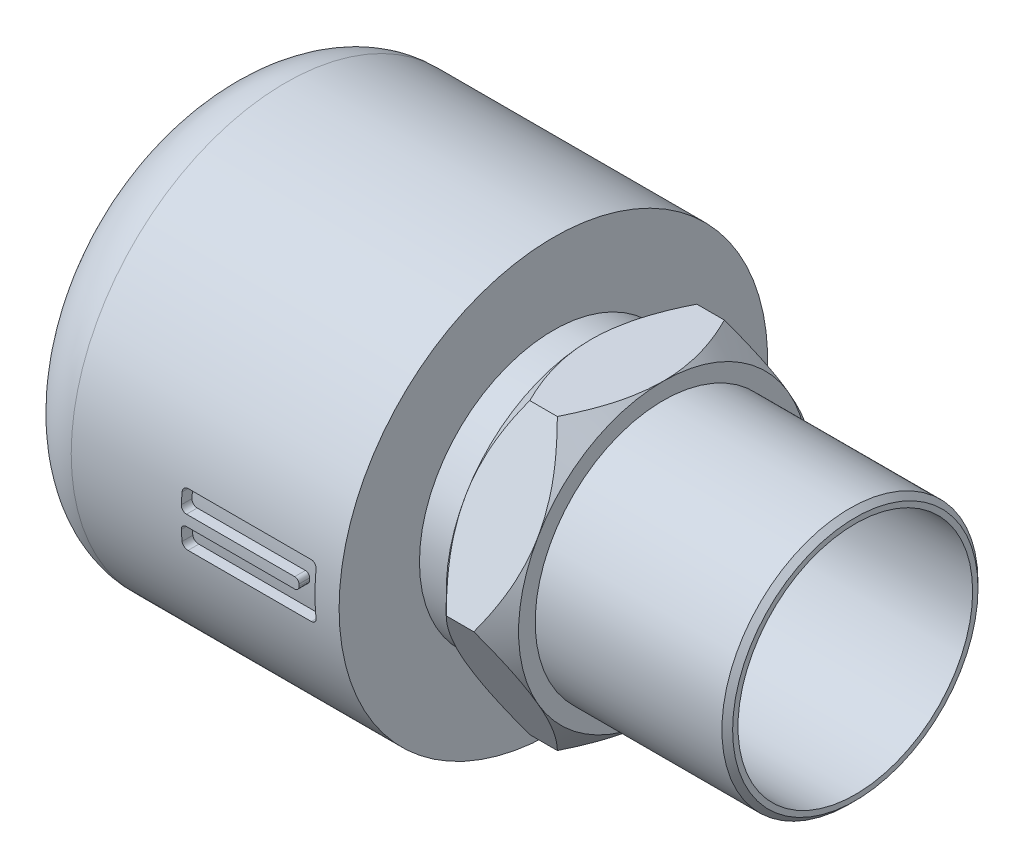
from build123d import *

# Parameters (mm, degrees)
EXTRUDE_1_DEPTH            = 13.5
SKETCH_2_OUTSIDE_W         = 121.07
SKETCH_2_OUTSIDE_H         = 112.716
SKETCH_2_OUTSIDE_R         = 27
CUT_EXTRUDE_1_DEPTH        = 20
CUT_EXTRUDE_1_DRAFT        = -45
SKETCH_3_OUTSIDE_W         = 121.07
SKETCH_3_OUTSIDE_H         = 112.716
SKETCH_3_OUTSIDE_R         = 27
CUT_EXTRUDE_2_DEPTH        = 20
CUT_EXTRUDE_2_DRAFT        = -45
SKETCH_4_R                 = 25
EXTRUDE_2_DEPTH            = 50
SKETCH_5_R                 = 20
CUT_EXTRUDE_3_DEPTH        = 36.5
SKETCH_6_R                 = 23.9
EXTRUDE_3_DEPTH            = 35.85
CHAMFER_1_SIZE             = 1
FILLET_1_R                 = 1
SKETCH_7_R                 = 21.9
CUT_EXTRUDE_4_DEPTH        = 96.24296562
EXTRUDE_START              = 7
SKETCH_8_R                 = 40
EXTRUDE_4_DEPTH            = 50
CUT_EXTRUDE_5_REACH        = 110.725
CUT_EXTRUDE_5_START_RADIUS = 40
CUT_EXTRUDE_5_END_RADIUS   = 40


# Read off the part's stored shape, not the designer's step: Купол1
with BuildPart() as part:
    # Эскиз1 → Бобышка-Вытянуть1 (new body)
    with BuildSketch(Plane(origin=(0, 0, 0), x_dir=(0, 0, -1), z_dir=(1, 0, 0))):
        Polygon((31.176914536, 0), (15.588457268, 27), (-15.588457268, 27), (-31.176914536, 0), (-15.588457268, -27), (15.588457268, -27), align=None)
    extrude(amount=-EXTRUDE_1_DEPTH)


with BuildPart() as cut_extrude_1_tool:
    # Эскиз2 outside → Вырез-Вытянуть1 (with draft: the straight prism first)
    with BuildSketch(Plane(origin=(0, 0, 0), x_dir=(0, 0, -1), z_dir=(1, 0, 0))):
        Rectangle(SKETCH_2_OUTSIDE_W, SKETCH_2_OUTSIDE_H)
        Circle(SKETCH_2_OUTSIDE_R, mode=Mode.SUBTRACT)
    extrude(amount=-CUT_EXTRUDE_1_DEPTH)
    # Вырез-Вытянуть1: the draft: its side faces are tilted about the plane it starts from
    cut_extrude_1_sides = [cut_extrude_1_tool.faces().sort_by_distance(p)[0] for p in [
        (-10, -56.358, 0),
        (-10, 0, -60.535),
        (-10, 56.358, 0),
        (-10, 0, 60.535),
        (-10, 0, 27),
    ]]
    draft(cut_extrude_1_sides, Plane(origin=(0, 0, 0), x_dir=(0, 0, -1), z_dir=(1, 0, 0)), CUT_EXTRUDE_1_DRAFT)


with BuildPart() as part_1:
    add(part.part)

    # Вырез-Вытянуть1: cut by cut_extrude_1_tool
    add(cut_extrude_1_tool.part, mode=Mode.SUBTRACT)


with BuildPart() as cut_extrude_2_tool:
    # Эскиз3 outside → Вырез-Вытянуть2 (with draft: the straight prism first)
    with BuildSketch(Plane.ZY.offset(13.5)):
        Rectangle(SKETCH_3_OUTSIDE_W, SKETCH_3_OUTSIDE_H)
        Circle(SKETCH_3_OUTSIDE_R, mode=Mode.SUBTRACT)
    extrude(amount=-CUT_EXTRUDE_2_DEPTH)
    # Вырез-Вытянуть2: the draft: its side faces are tilted about the plane it starts from
    cut_extrude_2_sides = [cut_extrude_2_tool.faces().sort_by_distance(p)[0] for p in [
        (-3.5, -56.358, 0),
        (-3.5, 0, 60.535),
        (-3.5, 56.358, 0),
        (-3.5, 0, -60.535),
        (-3.5, 0, -27),
    ]]
    draft(cut_extrude_2_sides, Plane.ZY.offset(13.5), CUT_EXTRUDE_2_DRAFT)


with BuildPart() as part_2:
    add(part_1.part)

    # Вырез-Вытянуть2: cut by cut_extrude_2_tool
    add(cut_extrude_2_tool.part, mode=Mode.SUBTRACT)

    # Эскиз4 → Бобышка-Вытянуть2 (add)
    with BuildSketch(Plane(origin=(0, 0, 0), x_dir=(0, 0, -1), z_dir=(1, 0, 0))):
        Circle(SKETCH_4_R)
    extrude(amount=-EXTRUDE_2_DEPTH)

    # Эскиз5 → Вырез-Вытянуть3 (cut)
    with BuildSketch(Plane.ZY.offset(50)):
        Circle(SKETCH_5_R)
    extrude(amount=-CUT_EXTRUDE_3_DEPTH, mode=Mode.SUBTRACT)

    # Эскиз6 → Бобышка-Вытянуть3 (add)
    with BuildSketch(Plane(origin=(0, 0, 0), x_dir=(0, 0, -1), z_dir=(1, 0, 0))):
        Circle(SKETCH_6_R)
    extrude(amount=EXTRUDE_3_DEPTH)

    # Фаска1
    chamfer_1_edges = [part_2.edges().sort_by_distance(p)[0] for p in [
        (35.85, 0, 23.9),
    ]]
    chamfer(chamfer_1_edges, length=CHAMFER_1_SIZE)

    # Скругление1
    fillet_1_edges = [part_2.edges().sort_by_distance(p)[0] for p in [
        (-50, 0, 25),
        (-50, 0, -20),
    ]]
    fillet(fillet_1_edges, radius=FILLET_1_R)

    # Эскиз7 → Вырез-Вытянуть4 (cut, through all)
    with BuildSketch(Plane(origin=(35.85, 0, 0), x_dir=(0, 0, -1), z_dir=(1, 0, 0))):
        Circle(SKETCH_7_R)
    extrude(amount=-CUT_EXTRUDE_4_DEPTH, mode=Mode.SUBTRACT)

    # Эскиз8 → Бобышка-Вытянуть4 (add)
    with BuildSketch(Plane.ZY.offset(13.5).offset(EXTRUDE_START)):
        Circle(SKETCH_8_R)
    extrude(amount=EXTRUDE_4_DEPTH)

    # Купол1 outline → Купол1 (revolve)
    with BuildSketch(Plane.YX):
        with BuildLine():
            Line((0, -70.5), (0, -90.5))
            add(Edge.make_bspline(
                [(0, -90.5), (40, -90.5), (40, -70.5)],
                knots=[4.71238898, 4.71238898, 4.71238898, 6.283185307, 6.283185307, 6.283185307], degree=2, weights=[1, 0.707106781, 1]))
            Line((40, -70.5), (0, -70.5))
        make_face()
    revolve(axis=Axis((0, 0, 0), (1, 0, 0)))

    # Вырез-Вытянуть5: from a cylinder face, 110.725 long prism both ways, kept between that surface and its translate by the depth
    cut_extrude_5_start = Plane(origin=(-38.9, 0, 0), z_dir=(1, 0, 0)) * Cylinder(CUT_EXTRUDE_5_START_RADIUS, 302.45, mode=Mode.PRIVATE)
    cut_extrude_5_end = Plane(origin=(-38.9, 0, -2), z_dir=(1, 0, 0)) * Cylinder(CUT_EXTRUDE_5_END_RADIUS, 302.45, mode=Mode.PRIVATE)
    # Эскиз9 → Вырез-Вытянуть5 (cut, from a surface)
    with BuildSketch(Plane.XY, mode=Mode.PRIVATE) as cut_extrude_5_sk1:
        with BuildLine():
            Line((-28.8, -1), (-49, -1))
            ThreePointArc((-49, -1), (-49.707106781, -1.292893219), (-50, -2))
            Line((-50, -2), (-50, -4))
            ThreePointArc((-50, -4), (-49.707106781, -4.707106781), (-49, -5))
            Line((-49, -5), (-26, -5))
            ThreePointArc((-26, -5), (-25.292893219, -4.707106781), (-25, -4))
            Line((-25, -4), (-25, 4))
            ThreePointArc((-25, 4), (-25.292893219, 4.707106781), (-26, 5))
            Line((-26, 5), (-49, 5))
            ThreePointArc((-49, 5), (-49.707106781, 4.707106781), (-50, 4))
            Line((-50, 4), (-50, 2))
            ThreePointArc((-50, 2), (-49.707106781, 1.292893219), (-49, 1))
            Line((-49, 1), (-28.8, 1))
            ThreePointArc((-28.8, 1), (-28.234314575, 0.765685425), (-28, 0.2))
            Line((-28, 0.2), (-28, -0.2))
            ThreePointArc((-28, -0.2), (-28.234314575, -0.765685425), (-28.8, -1))
        make_face()
    cut_extrude_5_tool1 = extrude(cut_extrude_5_sk1.sketch, amount=CUT_EXTRUDE_5_REACH, both=True, mode=Mode.PRIVATE)
    add(((cut_extrude_5_tool1 & cut_extrude_5_start) - cut_extrude_5_end).solids().sort_by_distance((-38.9, 1.269258, 38.842885))[0], mode=Mode.SUBTRACT)


solid = part_2.part
